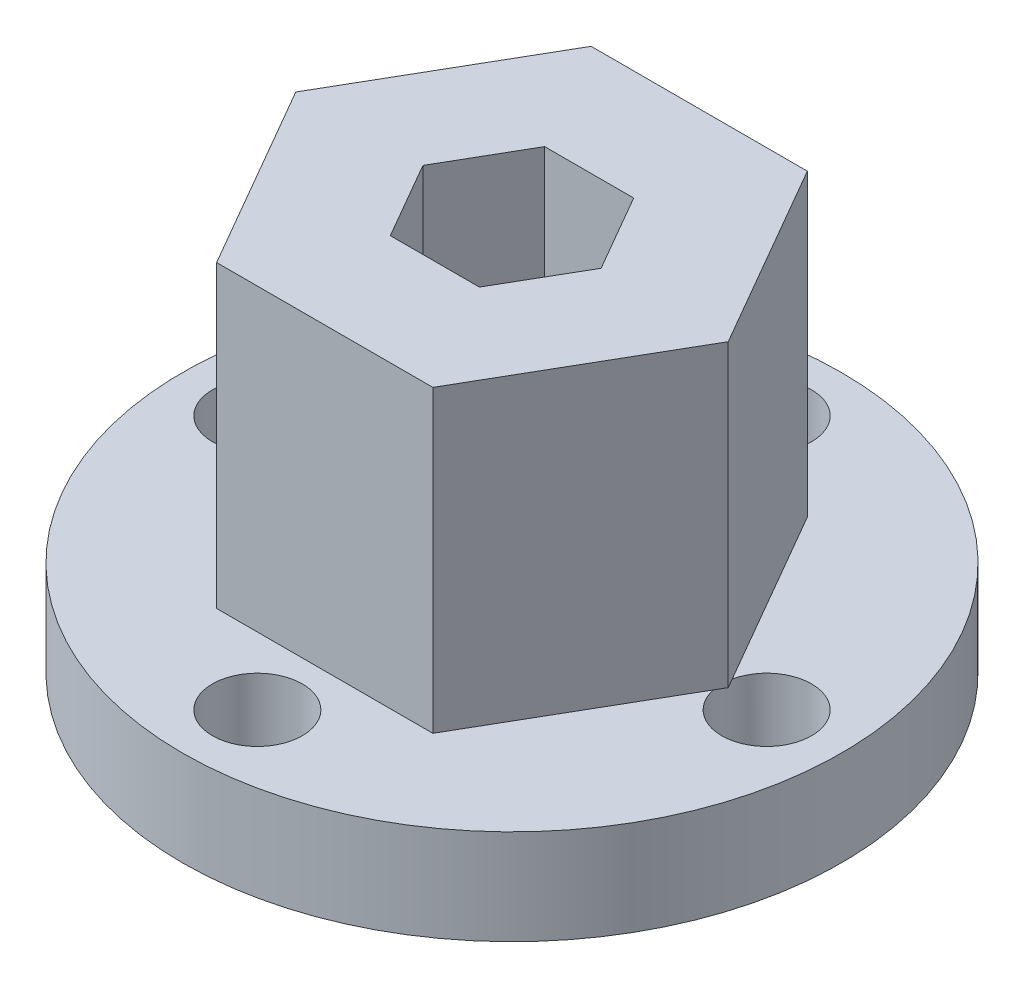
from build123d import *

# Parameters (mm, degrees)
SKETCH1_R           = 11
BOSS_EXTRUDE1_DEPTH = 3.175
BOSS_EXTRUDE2_DEPTH = 10
CUT_EXTRUDE2_DEPTH  = 28
SKETCH6_R           = 1.5
CUT_EXTRUDE3_DEPTH  = 8


with BuildPart() as part:
    # Sketch1 → Boss-Extrude1 (new body)
    with BuildSketch(Plane(origin=(0, 0, 0), x_dir=(1, 0, 0), z_dir=(0, 1, 0))):
        Circle(SKETCH1_R)
    extrude(amount=BOSS_EXTRUDE1_DEPTH)

    # Sketch2 → Boss-Extrude2 (add)
    with BuildSketch(Plane(origin=(0, 3.175, 0), x_dir=(1, 0, 0), z_dir=(0, 1, 0))):
        Polygon((3.608439182, -6.25), (7.216878365, 0), (3.608439182, 6.25), (-3.608439182, 6.25), (-7.216878365, 0), (-3.608439182, -6.25), align=None)
    extrude(amount=BOSS_EXTRUDE2_DEPTH)

    # Sketch3 → Cut-Extrude2 (cut)
    with BuildSketch(Plane(origin=(0, 13.175, 0), x_dir=(1, 0, 0), z_dir=(0, 1, 0))):
        Polygon((1.486676943, -2.575), (2.973353886, 0), (1.486676943, 2.575), (-1.486676943, 2.575), (-2.973353886, 0), (-1.486676943, -2.575), align=None)
    extrude(amount=-CUT_EXTRUDE2_DEPTH, mode=Mode.SUBTRACT)

    # Sketch6 → Cut-Extrude3 (cut)
    with BuildSketch(Plane(origin=(0, 3.175, 0), x_dir=(1, 0, 0), z_dir=(0, 1, 0))):
        with Locations((0, 8.5)):
            Circle(SKETCH6_R)
        with Locations((8.5, 0)):
            Circle(SKETCH6_R)
        with Locations((0, -8.5)):
            Circle(SKETCH6_R)
        with Locations((-8.5, 0)):
            Circle(SKETCH6_R)
    extrude(amount=-CUT_EXTRUDE3_DEPTH, mode=Mode.SUBTRACT)


solid = part.part
